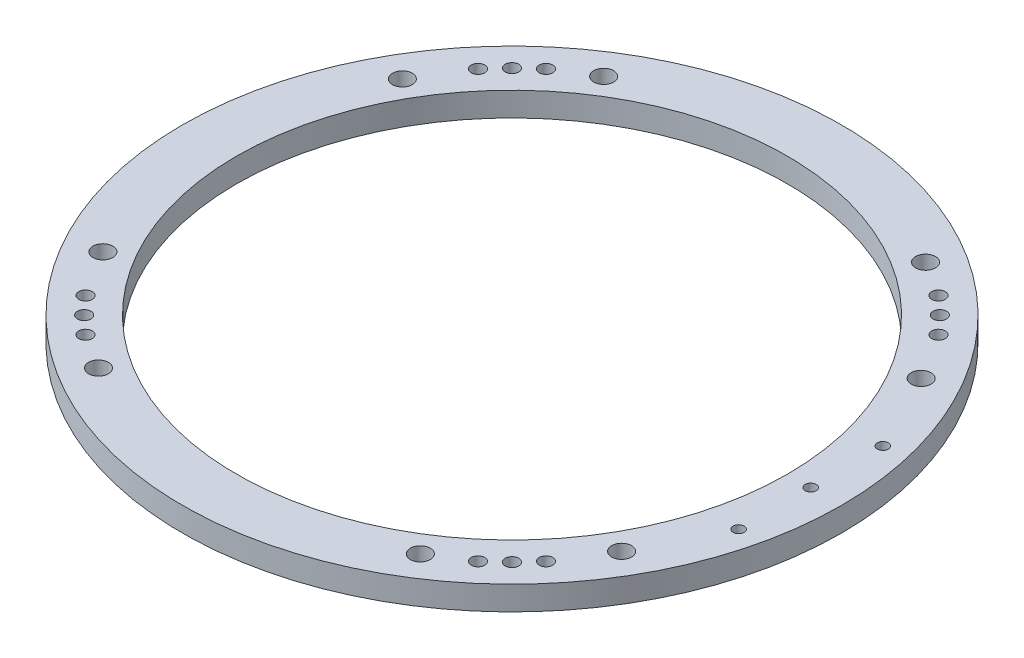
from build123d import *

# Parameters (mm, degrees)
F_9_32_0_28125_DIAMETER_HOLE1_D = 7.14375
CIRPATTERN1_COUNT               = 4
M5_CLEARANCE_HOLE1_D            = 5.8
Z_0_413_DIAMETER_HOLE1_D        = 10.4902


with BuildPart() as part:
    # Sketch1 → Revolve1 (revolve)
    with BuildSketch(Plane.XY):
        Polygon((145.526233777, 1064.895), (145.526233777, 1052.195), (152.4, 1052.195), (174.101233777, 1052.195), (174.101233777, 1064.895), align=None)
    revolve(axis=Axis((0, 1125.81516809, 0), (0, -1, 0)))

    # 9/32 (0.28125) Diameter Hole1 (through all)
    with Locations(Plane(origin=(0, 1052.195, 0), x_dir=(-1, 0, 0), z_dir=(0, -1, 0))):
        with Locations((103.667734326, 121.628246568), (121.628246568, 103.667734326), (113.00537488, 113.00537488)):
            f_9_32_0_28125_diameter_hole1 = Hole(F_9_32_0_28125_DIAMETER_HOLE1_D / 2)

    # CirPattern1: 9/32 (0.28125) Diameter Hole1 ×4 about axis
    cirpattern1_axis = Axis((0, 1125.81516809, 0), (0, 1, 0))
    for i in range(1, CIRPATTERN1_COUNT):
        add(f_9_32_0_28125_diameter_hole1.rotate(cirpattern1_axis, i * 360 / CIRPATTERN1_COUNT), mode=Mode.SUBTRACT)

    # M5 Clearance Hole1 (through all)
    with Locations(Plane(origin=(0, 1064.895, 0), x_dir=(1, 0, 0), z_dir=(0, 1, 0))):
        with Locations((157.7975, -38.1), (157.7975, 0), (157.7975, 38.1)):
            Hole(M5_CLEARANCE_HOLE1_D / 2)

    # Z (0.413) Diameter Hole1 (through all)
    with Locations(Plane(origin=(0, 1064.895, 0), x_dir=(1, 0, 0), z_dir=(0, 1, 0))):
        with Locations((-137.027937996, -79.113116888), (137.027937996, -79.113116888), (137.027937996, 79.113116888), (-137.027937996, 79.113116888), (-85.014893438, 133.44665207), (85.014893438, 133.44665207), (85.014893438, -133.44665207), (-85.014893438, -133.44665207)):
            Hole(Z_0_413_DIAMETER_HOLE1_D / 2)


solid = part.part
